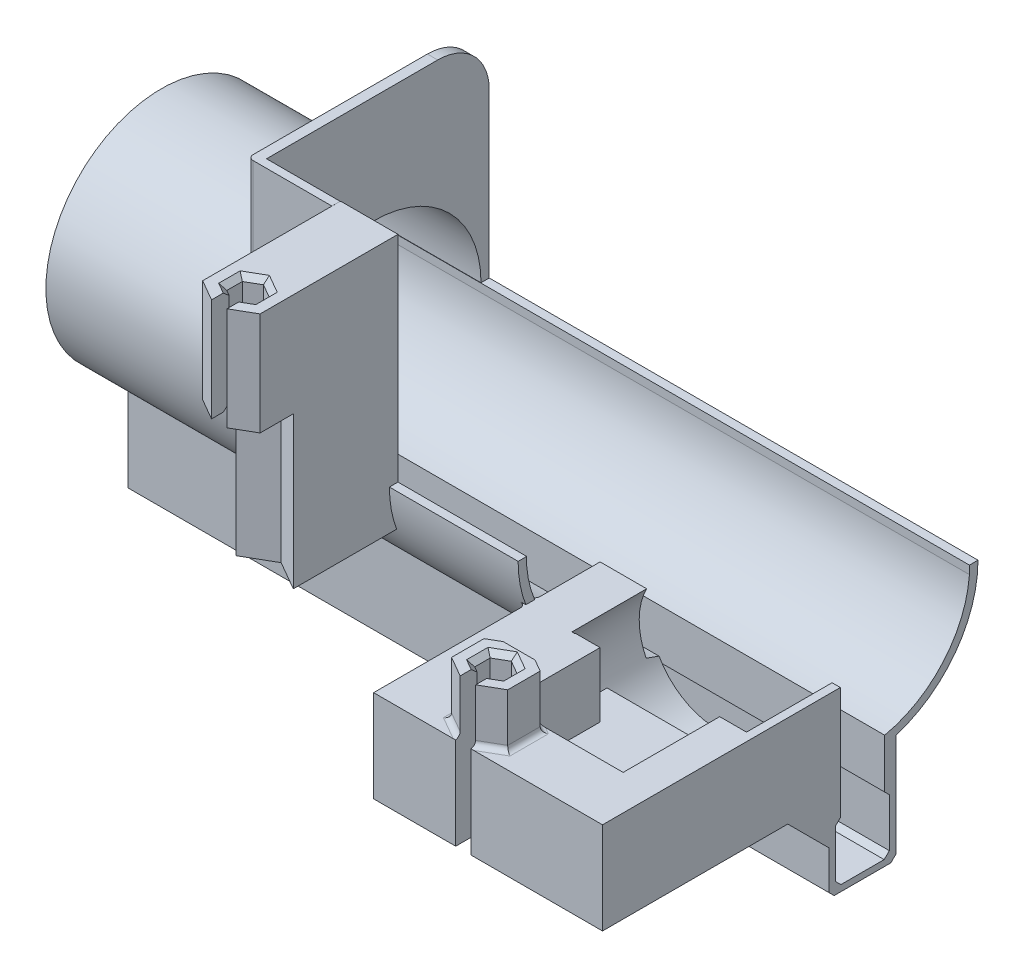
from build123d import *
from build123d.topology import SkipClean

# Parameters (mm, degrees)
SKETCH1_W            = 136
SKETCH1_H            = 13
BOSS_EXTRUDE1_DEPTH  = 21
CUT_EXTRUDE1_DEPTH   = 135
CHAMFER1_SIZE        = 1
CHAMFER2_SIZE        = 1
SKETCH6_W            = 135
SKETCH6_H            = 8.6
CUT_EXTRUDE3_DEPTH   = 9
SKETCH8_W            = 1.5
SKETCH8_H            = 7.54
CUT_EXTRUDE5_DEPTH   = 1
BOSS_EXTRUDE3_DEPTH  = 136
SKETCH11_R           = 22.4
SKETCH11_R_2         = 20.8
BOSS_EXTRUDE6_DEPTH  = 41.2
SKETCH6_5_W          = 135
SKETCH6_5_H          = 8.6
CUT_EXTRUDE11_DEPTH  = 35
SKETCH6_6_W          = 135
SKETCH6_6_H          = 8.6
CUT_EXTRUDE12_DEPTH  = 1
SKETCH13_W           = 47
SKETCH13_H           = 22
CUT_EXTRUDE13_DEPTH  = 32
BOSS_EXTRUDE7_DEPTH  = 22
BOSS_EXTRUDE8_DEPTH  = 4.79
BOSS_EXTRUDE10_DEPTH = 16.45
SKETCH18_R           = 13
CUT_EXTRUDE14_DEPTH  = 8
CUT_EXTRUDE15_START  = 8
SKETCH18_2_R         = 13
CUT_EXTRUDE15_DEPTH  = 8
SKETCH21_W           = 23.2
SKETCH21_H           = 25.13
CUT_EXTRUDE16_DEPTH  = 12.5
BOSS_EXTRUDE11_DEPTH = 1.39
SKETCH21_2_W         = 23.2
SKETCH21_2_H         = 25.13
CUT_EXTRUDE18_DEPTH  = 33.8
CUT_EXTRUDE20_DEPTH  = 12.5
SKETCH24_R           = 1.2
CUT_EXTRUDE21_DEPTH  = 12
CUT_EXTRUDE22_DEPTH  = 30
CUT_EXTRUDE23_START  = 8
SKETCH18_3_R         = 13
CUT_EXTRUDE23_DEPTH  = 8
CHAMFER3_SIZE        = 8
SKETCH26_W           = 12.471765104
SKETCH26_H           = 2.2
CUT_EXTRUDE24_DEPTH  = 8
CUT_EXTRUDE25_DEPTH  = 11
SKETCH28_W           = 1.6
SKETCH28_H           = 2.2
BOSS_EXTRUDE14_DEPTH = 12.5
CUT_EXTRUDE26_START  = -6.5
CUT_EXTRUDE26_DEPTH  = 6.5
FILLET2_R            = 1
FILLET3_R            = 1
BOSS_EXTRUDE15_DEPTH = 2.601750673
FILLET5_R            = 1
FILLET6_R            = 1
BOSS_EXTRUDE16_DEPTH = 20
BOSS_EXTRUDE17_DEPTH = 49.4
SKETCH36_W           = 11.15
SKETCH36_H           = 7.78
CUT_EXTRUDE27_DEPTH  = 20
BOSS_EXTRUDE18_START = -2
BOSS_EXTRUDE18_DEPTH = 2
FILLET10_R           = 10
SKETCH39_W           = 14.281750673
SKETCH39_H           = 1.6
BOSS_EXTRUDE19_DEPTH = 41.62
FILLET11_R           = 1
CUT_EXTRUDE28_DEPTH  = 25
CUT_EXTRUDE31_DEPTH  = 30
CHAMFER4_SIZE        = 1
CHAMFER5_SIZE        = 1


with BuildPart() as part:
    # Sketch1 → Boss-Extrude1 (new body)
    with BuildSketch(Plane(origin=(0, 0, 0), x_dir=(1, 0, 0), z_dir=(0, 1, 0))):
        with Locations((68, 6.5)):
            Rectangle(SKETCH1_W, SKETCH1_H)
    extrude(amount=BOSS_EXTRUDE1_DEPTH)

    # Sketch4 → Cut-Extrude1 (cut)
    with BuildSketch(Plane(origin=(136, 0, 0), x_dir=(0, 0, -1), z_dir=(1, 0, 0))):
        Polygon((1.3, 2.2), (2.3, 1.2), (10.7, 1.2), (11.7, 2.2), (11.7, 11.6), (10.7, 12.6), (2.3, 12.6), (1.3, 11.6), align=None)
    extrude(amount=-CUT_EXTRUDE1_DEPTH, mode=Mode.SUBTRACT)

    # Chamfer1
    chamfer1_edges = [part.edges().sort_by_distance(p)[0] for p in [
        (68, 0, 0),
    ]]
    chamfer(chamfer1_edges, length=CHAMFER1_SIZE)

    # Chamfer2
    chamfer2_edges = [part.edges().sort_by_distance(p)[0] for p in [
        (68, 0, -13),
    ]]
    chamfer(chamfer2_edges, length=CHAMFER2_SIZE)

    # Sketch6 → Cut-Extrude3 (cut)
    with BuildSketch(Plane(origin=(0, 21, 0), x_dir=(1, 0, 0), z_dir=(0, 1, 0))):
        with Locations((68.5, 6.5)):
            Rectangle(SKETCH6_W, SKETCH6_H)
    extrude(amount=-CUT_EXTRUDE3_DEPTH, mode=Mode.SUBTRACT)

    # Sketch8 → Cut-Extrude5 (cut)
    with BuildSketch(Plane.ZY):
        with Locations((-9.75, 16.23)):
            Rectangle(SKETCH8_W, SKETCH8_H)
        with Locations((-3.25, 16.23)):
            Rectangle(SKETCH8_W, SKETCH8_H)
    extrude(amount=-CUT_EXTRUDE5_DEPTH, mode=Mode.SUBTRACT)



with BuildPart() as body_2:
    # Sketch9 → Boss-Extrude3 (new body)
    with BuildSketch(Plane.ZY):
        with BuildLine():
            Line((-28.9, 42.4), (-27.238370235, 42.4))
            Line((-27.238370235, 42.4), (-27.238370235, 40.8))
            ThreePointArc((-27.238370235, 40.8), (-6.5, 21.6), (14.238370235, 40.8))
            Line((14.238370235, 40.8), (14.238370235, 42.4))
            Line((14.238370235, 42.4), (15.9, 42.4))
            ThreePointArc((15.9, 42.4), (-6.5, 20), (-28.9, 42.4))
        make_face()
    extrude(amount=-BOSS_EXTRUDE3_DEPTH)


with BuildPart() as part_1:
    add(part.part)

    add(body_2.part)  # Boss-Extrude6 merges body 2
    # Sketch11 → Boss-Extrude6 (add)
    with BuildSketch(Plane.ZY):
        with Locations((-6.5, 42.4)):
            Circle(SKETCH11_R)
        with Locations((-6.5, 42.4)):
            Circle(SKETCH11_R_2, mode=Mode.SUBTRACT)
    extrude(amount=-BOSS_EXTRUDE6_DEPTH)

    # Sketch6<5> → Cut-Extrude11 (cut)
    with BuildSketch(Plane(origin=(0, 21, 0), x_dir=(1, 0, 0), z_dir=(0, 1, 0))):
        with Locations((68.5, 6.5)):
            Rectangle(SKETCH6_5_W, SKETCH6_5_H)
    extrude(amount=CUT_EXTRUDE11_DEPTH, mode=Mode.SUBTRACT)

    # Sketch6<6> → Cut-Extrude12 (cut)
    with BuildSketch(Plane(origin=(0, 21, 0), x_dir=(1, 0, 0), z_dir=(0, 1, 0))):
        with Locations((68.5, 6.5)):
            Rectangle(SKETCH6_6_W, SKETCH6_6_H)
    extrude(amount=-CUT_EXTRUDE12_DEPTH, mode=Mode.SUBTRACT)

    # Sketch13 → Cut-Extrude13 (cut)
    with BuildSketch(Plane.XY):
        with Locations((112.5, 31.963815638)):
            Rectangle(SKETCH13_W, SKETCH13_H)
    extrude(amount=CUT_EXTRUDE13_DEPTH, mode=Mode.SUBTRACT)



with BuildPart() as body_2_2:
    # Sketch16 → Boss-Extrude7 (new body)
    with BuildSketch(Plane(origin=(0, 22.7, 0), x_dir=(1, 0, 0), z_dir=(0, 1, 0))):
        Polygon((109.021750673, -31.35), (103.574450883, -34.495), (103.574450883, -40.785), (109.021750673, -43.93), (114.469050463, -40.785), (114.469050463, -34.495), align=None)
        Polygon((109.021750673, -40.64), (111.619826884, -39.14), (111.619826884, -36.14), (109.021750673, -34.64), (106.423674461, -36.14), (106.423674461, -39.14), align=None, mode=Mode.SUBTRACT)
    extrude(amount=BOSS_EXTRUDE7_DEPTH)

    # Sketch16<2> → Boss-Extrude8 (add)
    with BuildSketch(Plane(origin=(0, 22.7, 0), x_dir=(1, 0, 0), z_dir=(0, 1, 0))):
        Polygon((109.021750673, -31.35), (103.574450883, -34.495), (103.574450883, -40.785), (109.021750673, -43.93), (114.469050463, -40.785), (114.469050463, -34.495), align=None)
        Polygon((109.021750673, -40.64), (111.619826884, -39.14), (111.619826884, -36.14), (109.021750673, -34.64), (106.423674461, -36.14), (106.423674461, -39.14), align=None, mode=Mode.SUBTRACT)
    extrude(amount=-BOSS_EXTRUDE8_DEPTH)


with BuildPart() as part_2:
    add(part_1.part)

    add(body_2_2.part)  # Boss-Extrude10 merges body 2 2
    # Sketch17 → Boss-Extrude10 (add)
    with BuildSketch(Plane.XZ.offset(-17.91)):
        Polygon((94.021750673, 43.93), (136, 43.93), (136, 0), (94.021750673, 0), (91.601750673, 0), (91.601750673, 43.93), align=None)
    extrude(amount=-BOSS_EXTRUDE10_DEPTH)

    # Sketch18 → Cut-Extrude14 (cut)
    with BuildSketch(Plane.XY):
        with Locations((112.185002614, 28.4)):
            Circle(SKETCH18_R)
    extrude(amount=-CUT_EXTRUDE14_DEPTH, mode=Mode.SUBTRACT)

    # Sketch18<2> → Cut-Extrude15 (cut)
    with BuildSketch(Plane.XY.offset(CUT_EXTRUDE15_START)):
        with Locations((112.185002614, 28.4)):
            Circle(SKETCH18_2_R)
    extrude(amount=-CUT_EXTRUDE15_DEPTH, mode=Mode.SUBTRACT)

    # Sketch21 → Cut-Extrude16 (cut)
    with BuildSketch(Plane(origin=(0, 34.36, 0), x_dir=(1, 0, 0), z_dir=(0, 1, 0))):
        with Locations((117.6, -20.565)):
            Rectangle(SKETCH21_W, SKETCH21_H)
    extrude(amount=-CUT_EXTRUDE16_DEPTH, mode=Mode.SUBTRACT)

    # Sketch17<3> → Boss-Extrude11 (add)
    with BuildSketch(Plane.XZ.offset(-17.91)):
        Polygon((94.021750673, 43.93), (136, 43.93), (136, 0), (94.021750673, 0), (91.601750673, 0), (91.601750673, 43.93), align=None)
    extrude(amount=BOSS_EXTRUDE11_DEPTH)

    # Sketch21<2> → Cut-Extrude18 (cut)
    with BuildSketch(Plane(origin=(0, 34.36, 0), x_dir=(1, 0, 0), z_dir=(0, 1, 0))):
        with Locations((117.6, -20.565)):
            Rectangle(SKETCH21_2_W, SKETCH21_2_H)
    extrude(amount=CUT_EXTRUDE18_DEPTH, mode=Mode.SUBTRACT)

    # Sketch23 → Cut-Extrude20 (cut)
    with BuildSketch(Plane(origin=(0, 34.36, 0), x_dir=(1, 0, 0), z_dir=(0, 1, 0))):
        Polygon((101.2, -8), (123.738287861, -8), (123.738287861, 0.5), (134.4, 0.5), (134.4, -8), (134.4, -14.4), (101.2, -14.4), align=None)
    extrude(amount=-CUT_EXTRUDE20_DEPTH, mode=Mode.SUBTRACT)

    # Sketch24 → Cut-Extrude21 (cut)
    with BuildSketch(Plane(origin=(0, 0, 14.4), x_dir=(-1, 0, 0), z_dir=(0, 0, -1))):
        with Locations((-131.31, 28.41)):
            Circle(SKETCH24_R)
        with Locations((-103.81, 28.41)):
            Circle(SKETCH24_R)
    extrude(amount=-CUT_EXTRUDE21_DEPTH, mode=Mode.SUBTRACT)

    # Sketch25 → Cut-Extrude22 (cut)
    with BuildSketch(Plane.XZ.offset(-16.52)):
        Polygon((109.021750673, 34.64), (111.619826884, 36.14), (111.619826884, 39.14), (109.021750673, 40.64), (106.423674461, 39.14), (106.423674461, 36.14), align=None)
    extrude(amount=-CUT_EXTRUDE22_DEPTH, mode=Mode.SUBTRACT)

    # Sketch18<3> → Cut-Extrude23 (cut)
    with BuildSketch(Plane.XY.offset(CUT_EXTRUDE23_START)):
        with Locations((112.185002614, 28.4)):
            Circle(SKETCH18_3_R)
    extrude(amount=-CUT_EXTRUDE23_DEPTH, mode=Mode.SUBTRACT)

    # Chamfer3
    # the kernel refuses this chamfer: 8, 6.06103424 mm, written as the material it adds along each edge
    with BuildSketch(Plane(origin=(127.479678778, 16.52, 0), x_dir=(0, 0, 1), z_dir=(-1, 0, 0))) as chamfer3_piece_1_section:
        Polygon((CHAMFER3_SIZE, 0), (0, -CHAMFER3_SIZE), (0, 0), align=None)
    chamfer3_piece_1 = extrude(amount=35.877928106, mode=Mode.PRIVATE)
    chamfer3_piece_1 = chamfer3_piece_1 - Plane(origin=(112.185002614, 28.4, 0), x_dir=(1, 0, 0), z_dir=(0, 0, 1)) * Cylinder(13, 104, mode=Mode.PRIVATE)
    add(chamfer3_piece_1)
    with BuildSketch(Plane(origin=(136, 16.52, 0), x_dir=(0, 0, 1), z_dir=(-1, 0, 0))) as chamfer3_piece_2_section:
        Polygon((CHAMFER3_SIZE, 0), (0, -CHAMFER3_SIZE), (0, 0), align=None)
    chamfer3_piece_2 = extrude(amount=39.10967355, mode=Mode.PRIVATE)
    chamfer3_piece_2 = chamfer3_piece_2 - Plane(origin=(112.185002614, 28.4, 0), x_dir=(1, 0, 0), z_dir=(0, 0, 1)) * Cylinder(13, 111, mode=Mode.PRIVATE)
    add(chamfer3_piece_2)

    # Sketch26 → Cut-Extrude24 (cut)
    with BuildSketch(Plane(origin=(0, 21.86, 0), x_dir=(1, 0, 0), z_dir=(0, 1, 0))):
        with Locations((129.764117448, 1.1)):
            Rectangle(SKETCH26_W, SKETCH26_H)
    extrude(amount=CUT_EXTRUDE24_DEPTH, mode=Mode.SUBTRACT)

    # Sketch27 → Cut-Extrude25 (cut)
    with BuildSketch(Plane.XY.offset(8)):
        Polygon((123.738287861, 21.86), (123.738287861, 22.44), (123.420143913, 21.86), align=None)
    extrude(amount=-CUT_EXTRUDE25_DEPTH, mode=Mode.SUBTRACT)

    # Sketch28 → Boss-Extrude14 (add)
    with BuildSketch(Plane(origin=(0, 21.86, 0), x_dir=(1, 0, 0), z_dir=(0, 1, 0))):
        with Locations((135.2, 1.1)):
            Rectangle(SKETCH28_W, SKETCH28_H)
    extrude(amount=BOSS_EXTRUDE14_DEPTH)

    # Sketch29 → Cut-Extrude26 (cut)
    with SkipClean():  # the faces are left unmerged after this step: merging them gives an invalid solid
        with BuildSketch(Plane(origin=(0, 0, 8), x_dir=(-1, 0, 0), z_dir=(0, 0, -1)).offset(CUT_EXTRUDE26_START)):
            with BuildLine():
                Line((-101.2, 34.36), (-101.2, 21.86))
                Line((-101.2, 21.86), (-100.529870561, 22.6417106))
                ThreePointArc((-100.529870561, 22.6417106), (-99.185493585, 28.512982231), (-100.631717367, 34.36))
                Line((-100.631717367, 34.36), (-101.2, 34.36))
            make_face()
            with BuildLine():
                Line((-100.529870561, 22.6417106), (-101.2, 21.86))
                Line((-101.2, 21.86), (-100.949861316, 21.86))
                ThreePointArc((-100.949861316, 21.86), (-100.733193962, 22.247270638), (-100.529870561, 22.6417106))
            make_face()
        extrude(amount=CUT_EXTRUDE26_DEPTH, mode=Mode.SUBTRACT)

    # Fillet2
    # the kernel refuses this fillet: 1 mm, written as the material it adds along each edge
    with BuildSketch(Plane(origin=(114.469050463, 34.36, 43.285), x_dir=(1, 0, 0), z_dir=(0, 0, -1))) as fillet2_piece_1_section:
        with BuildLine():
            CenterArc((FILLET2_R, -FILLET2_R), FILLET2_R, 90, 90)
            Line((0, -FILLET2_R), (0, 0))
            Line((0, 0), (FILLET2_R, 0))
        make_face()
    fillet2_piece_1 = extrude(amount=11.29, mode=Mode.PRIVATE)
    fillet2_piece_1 = split(fillet2_piece_1, bisect_by=Plane(origin=(118.275232112, 34.36, 36.6925), z_dir=(-0.5000000000000013, 0, 0.8660254037844379)), keep=Keep.TOP, mode=Mode.PRIVATE)
    fillet2_piece_1 = split(fillet2_piece_1, bisect_by=Plane(origin=(113.386518708, 34.36, 41.41), z_dir=(-0.5000000000000012, 0, -0.866025403784438)), keep=Keep.TOP, mode=Mode.PRIVATE)
    add(fillet2_piece_1)
    with BuildSketch(Plane(origin=(116.634113972, 34.36, 35.745), x_dir=(0.5000000000000013, 0, -0.8660254037844379), z_dir=(-0.8660254037844379, 0, -0.5000000000000013))) as fillet2_piece_2_section:
        with BuildLine():
            CenterArc((FILLET2_R, -FILLET2_R), FILLET2_R, 90, 90)
            Line((0, -FILLET2_R), (0, 0))
            Line((0, 0), (FILLET2_R, 0))
        make_face()
    fillet2_piece_2 = extrude(amount=7.73, mode=Mode.PRIVATE)
    fillet2_piece_2 = split(fillet2_piece_2, bisect_by=Plane(origin=(116.634113972, 34.36, 33.13), z_dir=(0, 0, 1)), keep=Keep.TOP, mode=Mode.PRIVATE)
    fillet2_piece_2 = split(fillet2_piece_2, bisect_by=Plane(origin=(114.469050463, 34.36, 35.745), z_dir=(-1, 0, 0)), keep=Keep.TOP, mode=Mode.PRIVATE)
    add(fillet2_piece_2)
    with BuildSketch(Plane(origin=(106.856687163, 34.36, 45.18), x_dir=(0.5000000000000012, 0, 0.8660254037844379), z_dir=(0.866025403784438, 0, -0.5000000000000012))) as fillet2_piece_3_section:
        with BuildLine():
            CenterArc((FILLET2_R, -FILLET2_R), FILLET2_R, 90, 90)
            Line((0, -FILLET2_R), (0, 0))
            Line((0, 0), (FILLET2_R, 0))
        make_face()
    fillet2_piece_3 = extrude(amount=11.29, mode=Mode.PRIVATE)
    fillet2_piece_3 = split(fillet2_piece_3, bisect_by=Plane(origin=(106.856687163, 34.36, 43.93), z_dir=(0, 0, -1)), keep=Keep.TOP, mode=Mode.PRIVATE)
    fillet2_piece_3 = split(fillet2_piece_3, bisect_by=Plane(origin=(107.939218918, 34.36, 43.305), z_dir=(0.4999999999999987, 0, -0.8660254037844394)), keep=Keep.TOP, mode=Mode.PRIVATE)
    fillet2_piece_3 = split(fillet2_piece_3, bisect_by=Plane(origin=(114.469050463, 34.36, 45.18), z_dir=(-1, 0, 0)), keep=Keep.TOP, mode=Mode.PRIVATE)
    add(fillet2_piece_3)
    with BuildSketch(Plane(origin=(114.469050463, 34.36, 43.285), x_dir=(1, 0, 0), z_dir=(0, 0, -1))) as fillet2_piece_4a_section:
        with BuildLine():
            CenterArc((FILLET2_R, -FILLET2_R), FILLET2_R, 90, 90)
            Line((0, -FILLET2_R), (0, 0))
            Line((0, 0), (FILLET2_R, 0))
        make_face()
    fillet2_piece_4a = extrude(amount=11.29, mode=Mode.PRIVATE)
    fillet2_piece_4a = split(fillet2_piece_4a, bisect_by=Plane(origin=(113.386518708, 34.36, 41.41), z_dir=(0.5000000000000012, 0, 0.866025403784438)), keep=Keep.TOP, mode=Mode.PRIVATE)
    with BuildSketch(Plane(origin=(106.856687163, 34.36, 45.18), x_dir=(0.5000000000000012, 0, 0.8660254037844379), z_dir=(0.866025403784438, 0, -0.5000000000000012))) as fillet2_piece_4b_section:
        with BuildLine():
            CenterArc((FILLET2_R, -FILLET2_R), FILLET2_R, 90, 90)
            Line((0, -FILLET2_R), (0, 0))
            Line((0, 0), (FILLET2_R, 0))
        make_face()
    fillet2_piece_4b = extrude(amount=11.29, mode=Mode.PRIVATE)
    fillet2_piece_4b = split(fillet2_piece_4b, bisect_by=Plane(origin=(114.469050463, 34.36, 45.18), z_dir=(1, 0, 0)), keep=Keep.TOP, mode=Mode.PRIVATE)
    fillet2_piece_4 = fillet2_piece_4a & fillet2_piece_4b
    add(fillet2_piece_4)
    with BuildSketch(Plane(origin=(116.634113972, 34.36, 35.745), x_dir=(0.5000000000000013, 0, -0.8660254037844379), z_dir=(-0.8660254037844379, 0, -0.5000000000000013))) as fillet2_piece_5a_section:
        with BuildLine():
            CenterArc((FILLET2_R, -FILLET2_R), FILLET2_R, 90, 90)
            Line((0, -FILLET2_R), (0, 0))
            Line((0, 0), (FILLET2_R, 0))
        make_face()
    fillet2_piece_5a = extrude(amount=7.73, mode=Mode.PRIVATE)
    fillet2_piece_5a = split(fillet2_piece_5a, bisect_by=Plane(origin=(114.469050463, 34.36, 35.745), z_dir=(1, 0, 0)), keep=Keep.TOP, mode=Mode.PRIVATE)
    with BuildSketch(Plane(origin=(114.469050463, 34.36, 43.285), x_dir=(1, 0, 0), z_dir=(0, 0, -1))) as fillet2_piece_5b_section:
        with BuildLine():
            CenterArc((FILLET2_R, -FILLET2_R), FILLET2_R, 90, 90)
            Line((0, -FILLET2_R), (0, 0))
            Line((0, 0), (FILLET2_R, 0))
        make_face()
    fillet2_piece_5b = extrude(amount=11.29, mode=Mode.PRIVATE)
    fillet2_piece_5b = split(fillet2_piece_5b, bisect_by=Plane(origin=(114.469050463, 34.36, 33.13), z_dir=(0, 0, 1)), keep=Keep.TOP, mode=Mode.PRIVATE)
    fillet2_piece_5b = split(fillet2_piece_5b, bisect_by=Plane(origin=(118.275232112, 34.36, 36.6925), z_dir=(0.5000000000000013, 0, -0.8660254037844379)), keep=Keep.TOP, mode=Mode.PRIVATE)
    fillet2_piece_5 = fillet2_piece_5a & fillet2_piece_5b
    add(fillet2_piece_5)

    # Fillet3
    fillet3_edges = [part_2.edges().sort_by_distance(p)[0] for p in [
        (104.787225441, 34.36, 33.794804282),
        (103.574450883, 34.36, 37.64),
        (106.298100778, 34.36, 42.3575),
    ]]
    fillet(fillet3_edges, radius=FILLET3_R)

    # Sketch30 → Boss-Extrude15 (add)
    with BuildSketch(Plane(origin=(89, 0, 0), x_dir=(0, 0, -1), z_dir=(1, 0, 0))):
        with BuildLine():
            Line((-14.238370235, 40.8), (-14.238370235, 42.4))
            Line((-14.238370235, 42.4), (-15.9, 42.4))
            ThreePointArc((-15.9, 42.4), (-11.491108915, 29.055338146), (0, 20.963815638))
            Line((0, 20.963815638), (0, 22.6417106))
            ThreePointArc((0, 22.6417106), (-9.868050334, 29.565401126), (-14.238370235, 40.8))
        make_face()
    extrude(amount=BOSS_EXTRUDE15_DEPTH)

    # Fillet5
    # the kernel refuses this fillet: 1 mm, written as the material it adds along each edge
    with BuildSketch(Plane(origin=(91.601750673, 42.4, -6.5), x_dir=(0, -0.980537212362055, 0.19633332670041045), z_dir=(0, -0.19633332670041045, -0.980537212362055))) as fillet5_piece_1_section:
        with BuildLine():
            CenterArc((20.8 - FILLET5_R, FILLET5_R), FILLET5_R, 270, 90)
            Line((20.8, FILLET5_R), (20.8, 0))
            Line((20.8, 0), (20.8 - FILLET5_R, FILLET5_R * 2.94008373203e-10))
        make_face()
    fillet5_piece_1 = revolve(axis=Axis((91.601750673, 42.4, -6.5), (-1, 0, 0)), revolution_arc=62.825427053, mode=Mode.PRIVATE)
    fillet5_piece_1 = split(fillet5_piece_1, bisect_by=Plane(origin=(91.601750673, 34.36, -6.5), z_dir=(0, -1, 0)), keep=Keep.TOP, mode=Mode.PRIVATE)
    fillet5_piece_1 = split(fillet5_piece_1, bisect_by=Plane(origin=(91.601750673, 42.4, 0), z_dir=(0, 0, 1)), keep=Keep.TOP, mode=Mode.PRIVATE)
    add(fillet5_piece_1)

    # Fillet6
    fillet6_edges = [part_2.edges().sort_by_distance(p)[0] for p in [
        (91.601750673, 25.995595503, 8.753049305),
    ]]
    fillet(fillet6_edges, radius=FILLET6_R)

    # Sketch36 → Cut-Extrude27 (cut)
    with BuildSketch(Plane(origin=(0, 0, 14.238370235), x_dir=(-1, 0, 0), z_dir=(0, 0, -1))):
        with Locations((-61.056750673, 38.51)):
            Rectangle(SKETCH36_W, SKETCH36_H)
    extrude(amount=-CUT_EXTRUDE27_DEPTH, mode=Mode.SUBTRACT)

    # Sketch37 → Boss-Extrude18 (add)
    with BuildSketch(Plane(origin=(41.2, 0, 0), x_dir=(0, 0, -1), z_dir=(1, 0, 0)).offset(BOSS_EXTRUDE18_START)):
        with BuildLine():
            Line((-15.9, 42.4), (-15.9, 84.02))
            Line((-15.9, 84.02), (28.9, 84.02))
            Line((28.9, 84.02), (28.9, 42.4))
            ThreePointArc((28.9, 42.4), (6.5, 64.8), (-15.9, 42.4))
        make_face()
    extrude(amount=BOSS_EXTRUDE18_DEPTH)

    # Fillet10
    fillet10_edges = [part_2.edges().sort_by_distance(p)[0] for p in [
        (40.2, 84.02, -28.9),
    ]]
    fillet(fillet10_edges, radius=FILLET10_R)

    # Sketch39 → Boss-Extrude19 (add)
    with BuildSketch(Plane(origin=(0, 42.4, 0), x_dir=(1, 0, 0), z_dir=(0, 1, 0))):
        with Locations((48.340875337, -15.1)):
            Rectangle(SKETCH39_W, SKETCH39_H)
    extrude(amount=BOSS_EXTRUDE19_DEPTH)

    # Fillet11
    # the kernel refuses this fillet: 1 mm, written as the material it takes off along each edge
    with BuildSketch(Plane(origin=(39.2, 34.9, 15.9), x_dir=(0, 0, -1), z_dir=(0, 1, 0))) as fillet11_piece_1_section:
        with BuildLine():
            CenterArc((FILLET11_R, -FILLET11_R), FILLET11_R, 90, 90)
            Line((0, -FILLET11_R), (0, 0))
            Line((0, 0), (FILLET11_R, 0))
        make_face()
    fillet11_piece_1 = extrude(amount=51.62, mode=Mode.PRIVATE)
    fillet11_piece_1 = fillet11_piece_1 - Plane(origin=(39.2, 42.4, -6.5), x_dir=(0, 0, 1), z_dir=(-1, 0, 0)) * Cylinder(22.4, 108, mode=Mode.PRIVATE)
    add(fillet11_piece_1, mode=Mode.SUBTRACT)

    # Sketch41 → Cut-Extrude31 (cut)
    with BuildSketch(Plane(origin=(0, 44.7, 0), x_dir=(1, 0, 0), z_dir=(0, 1, 0))):
        Polygon((107.521750673, -39.773974596), (107.521750673, -43.063974596), (107.521750673, -44.703780199), (110.521750673, -44.703780199), (110.521750673, -43.063974596), (110.521750673, -39.773974596), (109.021750673, -40.64), align=None)
    extrude(amount=-CUT_EXTRUDE31_DEPTH, mode=Mode.SUBTRACT)

    # Chamfer5
    chamfer5_edges = [part_2.edges().sort_by_distance(p)[0] for p in [
        (106.972712567, 44.7, 39.456987298),
        (111.619826884, 44.7, 37.64),
        (110.320788778, 44.7, 35.39),
        (107.722712567, 44.7, 35.39),
        (106.423674461, 44.7, 37.64),
        (107.722712567, 16.52, 35.39),
        (110.320788778, 16.52, 35.39),
        (111.619826884, 16.52, 37.64),
        (111.070788778, 16.52, 39.456987298),
        (106.423674461, 16.52, 37.64),
        (111.070788778, 44.7, 39.456987298),
        (106.972712567, 16.52, 39.456987298),
    ]]
    chamfer(chamfer5_edges, length=CHAMFER5_SIZE)


with BuildPart() as body_2_3:
    # Sketch31 → Boss-Extrude16 (new body)
    with BuildSketch(Plane(origin=(0, 64.02, 0), x_dir=(1, 0, 0), z_dir=(0, 1, 0))):
        Polygon((61.061750673, -31.325), (55.488877199, -34.5425), (55.488877199, -40.9775), (61.061750673, -44.195), (66.634624146, -40.9775), (66.634624146, -34.5425), align=None)
        Polygon((61.061750673, -40.76), (63.659826884, -39.26), (63.659826884, -36.26), (61.061750673, -34.76), (58.463674461, -36.26), (58.463674461, -39.26), align=None, mode=Mode.SUBTRACT)
    extrude(amount=BOSS_EXTRUDE16_DEPTH)

    # Sketch32 → Boss-Extrude17 (add)
    with BuildSketch(Plane(origin=(0, 84.02, 0), x_dir=(1, 0, 0), z_dir=(0, 1, 0))):
        Polygon((66.634624146, -34.5425), (66.634624146, -14.238370235), (55.488877199, -14.238370235), (55.488877199, -34.5425), (61.061750673, -31.325), align=None)
    extrude(amount=-BOSS_EXTRUDE17_DEPTH)

    # Sketch40 → Cut-Extrude28 (cut)
    with BuildSketch(Plane(origin=(0, 84.02, 0), x_dir=(1, 0, 0), z_dir=(0, 1, 0))):
        Polygon((59.561750673, -39.893974596), (59.561750673, -43.328974596), (61.061750673, -44.195), (62.561750673, -43.328974596), (62.561750673, -39.893974596), (61.061750673, -40.76), align=None)
    extrude(amount=-CUT_EXTRUDE28_DEPTH, mode=Mode.SUBTRACT)

    # Chamfer4
    chamfer4_edges = [body_2_3.edges().sort_by_distance(p)[0] for p in [
        (59.012712567, 64.02, 39.576987298),
        (63.659826884, 64.02, 37.76),
        (62.360788778, 64.02, 35.51),
        (59.762712567, 64.02, 35.51),
        (58.463674461, 64.02, 37.76),
        (59.012712567, 84.02, 39.576987298),
        (63.659826884, 84.02, 37.76),
        (62.360788778, 84.02, 35.51),
        (59.762712567, 84.02, 35.51),
        (58.463674461, 84.02, 37.76),
        (63.110788778, 64.02, 39.576987298),
        (63.110788778, 84.02, 39.576987298),
    ]]
    chamfer(chamfer4_edges, length=CHAMFER4_SIZE)


solid = Compound([part_2.part, body_2_3.part])
